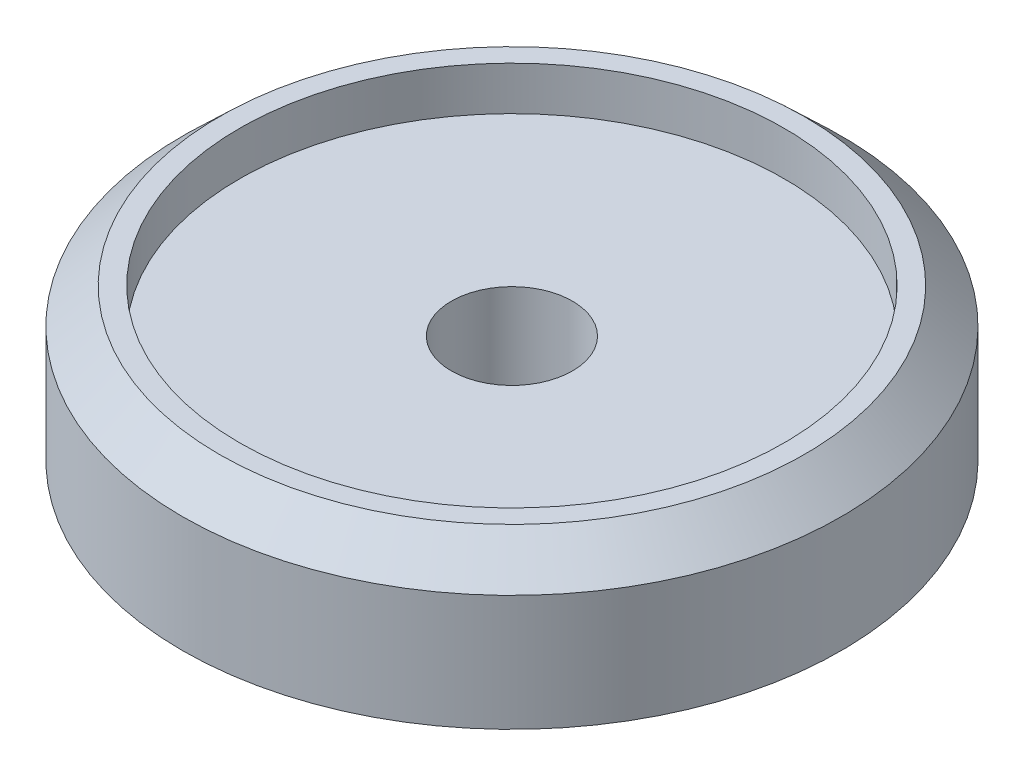
from build123d import *

# Parameters (mm, degrees)
SKETCH1_R           = 49
BOSS_EXTRUDE1_DEPTH = 16
SKETCH3_R           = 12
BOSS_EXTRUDE2_DEPTH = 25
SKETCH4_R           = 9
CUT_EXTRUDE1_DEPTH  = 81.517078934


with BuildPart() as part:
    # Sketch1 → Boss-Extrude1 (new body)
    with BuildSketch(Plane(origin=(0, 0, 0), x_dir=(1, 0, 0), z_dir=(0, 1, 0))):
        Circle(SKETCH1_R)
    extrude(amount=BOSS_EXTRUDE1_DEPTH)

    # Sketch2 → Revolve1 (revolve)
    with BuildSketch(Plane.XY):
        Polygon((-43.5, 22.5), (-40.5, 22.5), (-40.5, 16), (-49, 16), (-49, 17.25), align=None)
    revolve(axis=Axis((0, 16, 0), (0, -1, 0)))

    # Sketch3 → Boss-Extrude2 (add)
    with BuildSketch(Plane.XZ):
        Circle(SKETCH3_R)
    extrude(amount=BOSS_EXTRUDE2_DEPTH)

    # Sketch4 → Cut-Extrude1 (cut, through all)
    with BuildSketch(Plane(origin=(0, 16, 0), x_dir=(1, 0, 0), z_dir=(0, 1, 0))):
        Circle(SKETCH4_R)
    extrude(amount=-CUT_EXTRUDE1_DEPTH, mode=Mode.SUBTRACT)


solid = part.part
